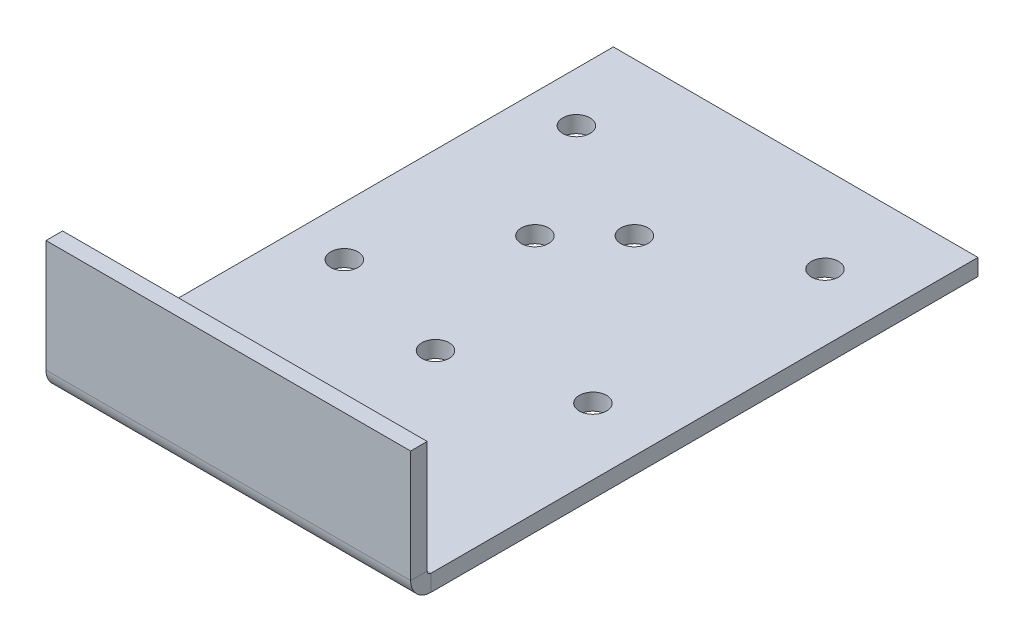
from build123d import *

# Parameters (mm, degrees)
SKETCH1_W                   = 69.85
SKETCH1_H                   = 101.6
BASE_FLANGE1_DEPTH          = 3.175
EDGE_FLANGE1_DEPTH          = 69.85
F_5_0_2055_DIAMETER_HOLE1_D = 5.2197


# Sheet-metal steps are written as plain solids
with BuildPart() as part:
    # Sketch1 → Base-Flange1 (new body)
    with BuildSketch(Plane(origin=(0, 0, 0), x_dir=(1, 0, 0), z_dir=(0, 1, 0))):
        with Locations((34.925, 50.8)):
            Rectangle(SKETCH1_W, SKETCH1_H)
    extrude(amount=-BASE_FLANGE1_DEPTH)

    # Edge-Flange1 section (across the edge) → Edge-Flange1 (add)
    with BuildSketch(Plane(origin=(0, 0, 3.9116), x_dir=(0, 0, -1), z_dir=(1, 0, 0))):
        with BuildLine():
            Line((-3.175, 0.7366), (-3.175, 22.225))
            Line((-3.175, 22.225), (0, 22.225))
            Line((0, 22.225), (0, 0.7366))
            ThreePointArc((0, 0.7366), (0.215745145, 0.215745145), (0.7366, 0))
            Line((0.7366, 0), (3.9116, 0))
            Line((3.9116, 0), (3.9116, -3.175))
            Line((3.9116, -3.175), (0.7366, -3.175))
            ThreePointArc((0.7366, -3.175), (-2.029318885, -2.029318885), (-3.175, 0.7366))
        make_face()
    extrude(amount=EDGE_FLANGE1_DEPTH)

    # #5 (0.2055) Diameter Hole1 (through all)
    with Locations(Plane.XZ.offset(3.175)):
        with Locations((33.3375, -34.1884), (23.8125, -62.7634), (33.3375, -72.2884), (57.15, -84.9884), (57.15, -40.5384), (9.525, -40.5384), (9.525, -84.9884)):
            Hole(F_5_0_2055_DIAMETER_HOLE1_D / 2)


solid = part.part
